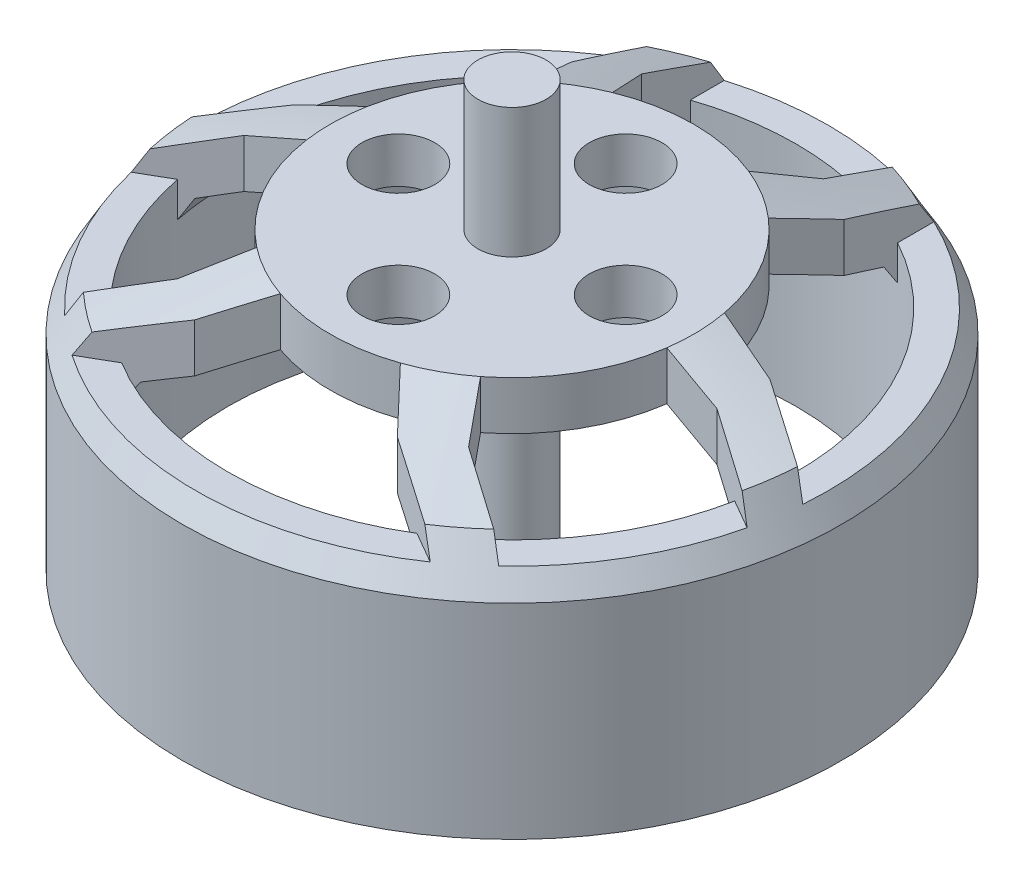
from build123d import *
from build123d.topology import SkipClean

# Parameters (mm, degrees)
CUT_EXTRUDE3_DEPTH    = 13.139810542
CUT_EXTRUDE4_START    = -1.5
CUT_EXTRUDE4_DEPTH    = 1.5
CUT_EXTRUDE5_START    = -1.5
CUT_EXTRUDE5_DEPTH    = 1.5
CIRPATTERN1_COUNT     = 3
BOSS_EXTRUDE4_START   = 2.85
SKETCH10_R            = 0.75
BOSS_EXTRUDE4_DEPTH   = 13.55
M2X0_4_TAPPED_HOLE1_D = 1.6


with BuildPart() as part:
    # Sketch6 → Revolve1 (revolve)
    with BuildSketch(Plane.XY, mode=Mode.PRIVATE) as revolve1_sk:
        Polygon((6.25, 0), (7.25, 0), (7.25, 4.5), (6.672649731, 5.5), (4, 6.5), (0, 6.5), (0, 5.5), (3.819045592, 5.5), (5.986074379, 4.689183393), (6.25, 4.232050808), align=None)
    revolve(revolve1_sk.sketch.rotate(Axis((0, -0.306020306, 0), (0, 1, 0)), 90), axis=Axis((0, -0.306020306, 0), (0, 1, 0)))

    # Sketch7 → Cut-Extrude3 (cut, through all)
    with SkipClean():  # the faces are left unmerged after this step: merging them gives an invalid solid
        with BuildSketch(Plane(origin=(0, 6.5, 0), x_dir=(1, 0, 0), z_dir=(0, 1, 0))):
            with BuildLine():
                Line((2.609895541, 3.031244837), (3, 4.308421985))
                Line((3, 4.308421985), (3, 5.48292805))
                ThreePointArc((3, 5.48292805), (5.412658774, 3.125), (6.248354978, -0.143387814))
                Line((6.248354978, -0.143387814), (5.231202889, 0.443865219))
                Line((5.231202889, 0.443865219), (3.930082805, 0.744613421))
                ThreePointArc((3.930082805, 0.744613421), (3.464101615, 2), (2.609895541, 3.031244837))
            make_face()
            with BuildLine():
                Line((1.5, 3.708099244), (2, 4.85412196))
                Line((2, 4.85412196), (2, 5.921359641))
                ThreePointArc((2, 5.921359641), (0, 6.25), (-2, 5.921359641))
                Line((-2, 5.921359641), (-2, 4.85412196))
                Line((-2, 4.85412196), (-1.5, 3.708099244))
                ThreePointArc((-1.5, 3.708099244), (0, 4), (1.5, 3.708099244))
            make_face()
            with BuildLine():
                Line((-2.609895541, 3.031244837), (-3, 4.308421985))
                Line((-3, 4.308421985), (-3, 5.48292805))
                ThreePointArc((-3, 5.48292805), (-5.412658774, 3.125), (-6.248354978, -0.143387814))
                Line((-6.248354978, -0.143387814), (-5.231202889, 0.443865219))
                Line((-5.231202889, 0.443865219), (-3.930082805, 0.744613421))
                ThreePointArc((-3.930082805, 0.744613421), (-3.464101615, 2), (-2.609895541, 3.031244837))
            make_face()
            with BuildLine():
                Line((5.20379293, -0.695010172), (6.128047874, -1.228629013))
                ThreePointArc((6.128047874, -1.228629013), (5.412658774, -3.125), (4.128047874, -4.692730628))
                Line((4.128047874, -4.692730628), (3.20379293, -4.159111787))
                Line((3.20379293, -4.159111787), (2.461308145, -3.153087727))
                ThreePointArc((2.461308145, -3.153087727), (3.464101615, -2), (3.961308145, -0.555011516))
                Line((3.961308145, -0.555011516), (5.20379293, -0.695010172))
            make_face()
            with BuildLine():
                Line((2.231202889, -4.752287204), (3.248354978, -5.339540236))
                ThreePointArc((3.248354978, -5.339540236), (0, -6.25), (-3.248354978, -5.339540236))
                Line((-3.248354978, -5.339540236), (-2.231202889, -4.752287204))
                Line((-2.231202889, -4.752287204), (-1.320187263, -3.775858259))
                ThreePointArc((-1.320187263, -3.775858259), (0, -4), (1.320187263, -3.775858259))
                Line((1.320187263, -3.775858259), (2.231202889, -4.752287204))
            make_face()
            with BuildLine():
                Line((-3.20379293, -4.159111787), (-4.128047874, -4.692730628))
                ThreePointArc((-4.128047874, -4.692730628), (-5.412658774, -3.125), (-6.128047874, -1.228629013))
                Line((-6.128047874, -1.228629013), (-5.20379293, -0.695010172))
                Line((-5.20379293, -0.695010172), (-3.961308145, -0.555011516))
                ThreePointArc((-3.961308145, -0.555011516), (-3.464101615, -2), (-2.461308145, -3.153087727))
                Line((-2.461308145, -3.153087727), (-3.20379293, -4.159111787))
            make_face()
        extrude(amount=-CUT_EXTRUDE3_DEPTH, mode=Mode.SUBTRACT)
    add(part.part.scale(1), mode=Mode.REPLACE)  # the faces are merged on a copy

    # Sketch8 → Cut-Extrude4 (cut)
    with BuildSketch(Plane(origin=(0, 6.5, 0), x_dir=(1, 0, 0), z_dir=(0, 1, 0)).offset(CUT_EXTRUDE4_START)):
        with BuildLine():
            Line((3, 5.48292805), (3, 6.600189391))
            ThreePointArc((3, 6.600189391), (6.278684177, 3.625), (7.215931683, -0.702018484))
            Line((7.215931683, -0.702018484), (6.248354978, -0.143387814))
            ThreePointArc((6.248354978, -0.143387814), (5.412658774, 3.125), (3, 5.48292805))
        make_face()
    cut_extrude4 = extrude(amount=CUT_EXTRUDE4_DEPTH, mode=Mode.SUBTRACT)

    # Sketch9 → Cut-Extrude5 (cut)
    with BuildSketch(Plane(origin=(0, 6.5, 0), x_dir=(1, 0, 0), z_dir=(0, 1, 0)).offset(CUT_EXTRUDE5_START)):
        with BuildLine():
            Line((-2, 5.921359641), (-2, 6.708203932))
            ThreePointArc((-2, 6.708203932), (0, 7), (2, 6.708203932))
            Line((2, 6.708203932), (2, 5.921359641))
            ThreePointArc((2, 5.921359641), (0, 6.25), (-2, 5.921359641))
        make_face()
    cut_extrude5 = extrude(amount=CUT_EXTRUDE5_DEPTH, mode=Mode.SUBTRACT)

    # CirPattern1: Cut-Extrude4, Cut-Extrude5 ×3 about axis
    cirpattern1_axis = Axis((0, 0, 0), (0, 1, 0))
    add([cut_extrude4.rotate(cirpattern1_axis, i * 360 / CIRPATTERN1_COUNT) for i in range(1, CIRPATTERN1_COUNT)], mode=Mode.SUBTRACT)
    add([cut_extrude5.rotate(cirpattern1_axis, i * 360 / CIRPATTERN1_COUNT) for i in range(1, CIRPATTERN1_COUNT)], mode=Mode.SUBTRACT)

    # Sketch10 → Boss-Extrude4 (add)
    with SkipClean():  # the faces are left unmerged after this step: merging them gives an invalid solid
        with BuildSketch(Plane(origin=(0, 6.5, 0), x_dir=(1, 0, 0), z_dir=(0, 1, 0)).offset(BOSS_EXTRUDE4_START)):
            with Locations(Location((0, 0, 0), (0, 0, 270))):
                Circle(SKETCH10_R)
        extrude(amount=-BOSS_EXTRUDE4_DEPTH)

    # M2x0.4 Tapped Hole1 (through all)
    with Locations(Plane(origin=(0, 6.5, 0), x_dir=(1, 0, 0), z_dir=(0, 1, 0))):
        with Locations((0, 2.5), (2.5, 0), (0, -2.5), (-2.5, 0)):
            Hole(M2X0_4_TAPPED_HOLE1_D / 2)


solid = part.part
